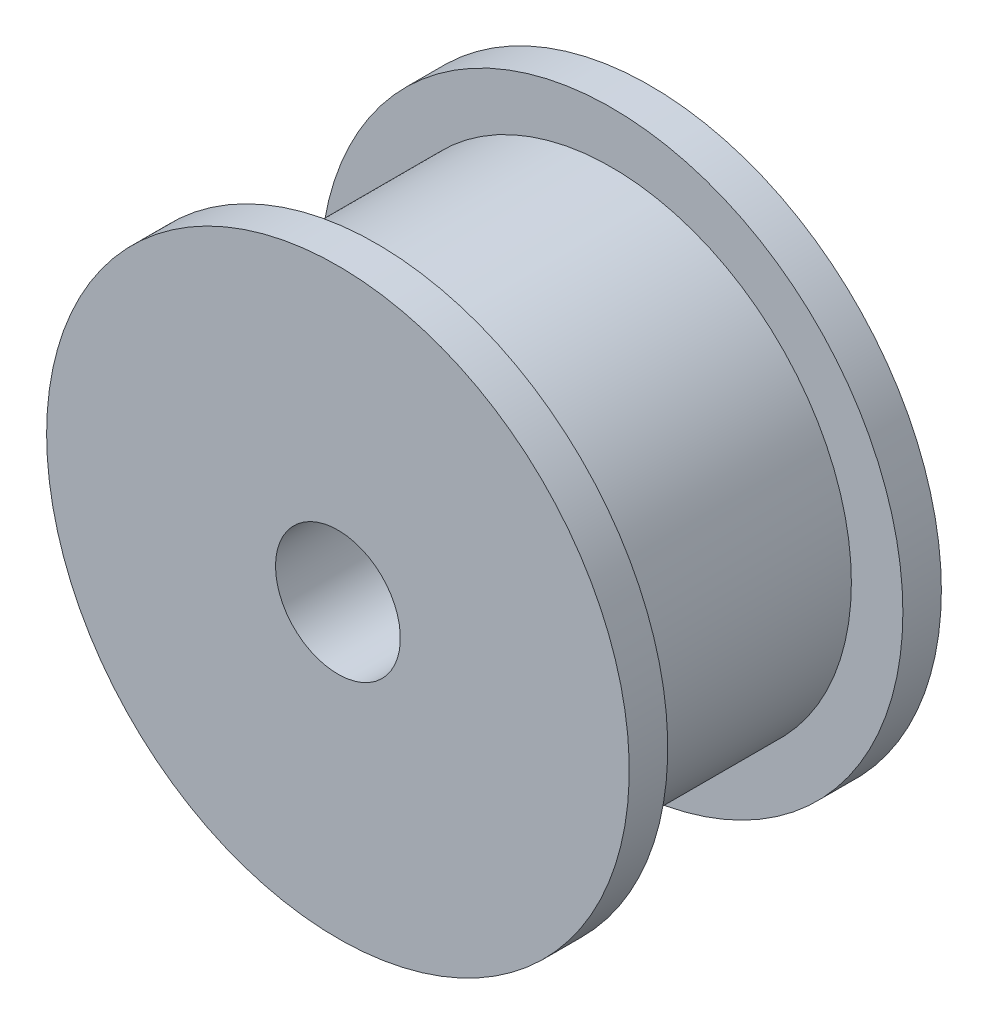
from build123d import *

# Parameters (mm, degrees)
CIRPATTERN2_COUNT       = 4
CHAMFER1_SIZE           = 0.3
CHAMFER2_SIZE           = 0.15
SKETCH6_R               = 5.05
CUT_EXTRUDE1_DEPTH      = 2
CHAMFER3_SIZE           = 0.3
SKETCH7_R               = 8
CUT_EXTRUDE2_DEPTH      = 6
CUT_EXTRUDE3_DEPTH      = 26.39125592
CUT_EXTRUDE3_DEPTH_BACK = 26.39125592
SKETCH10_R              = 22.04861813
SKETCH10_R_2            = 14


with BuildPart() as part:
    # Cut-Revolve1: read off the stored shape, not the designer's step
    # Cut-Revolve1 outline → Cut-Revolve1 (revolve)
    with BuildSketch(Plane.XZ):
        Polygon((11.525, 2.46), (15, 2.46), (16, 2.765730681), (15.628687935, 3.980237722), (14.810197228, 3.73), (8, 3.73), (8, 9.73), (3, 9.73), (3, -11.27), (14.810197228, -11.27), (15.628687935, -11.520237722), (16, -10.305730681), (15, -10), (11.525, -10), align=None)
    revolve(axis=Axis((0, 0, 0), (0, 0, 1)))

    # Sketch4 → M3 Tapped Hole2 (revolve, cut)
    with BuildSketch(Plane(origin=(0, -8, -11.27), x_dir=(0, 1, 0), z_dir=(1, 0, 0))):
        Polygon((0, 0), (0, 9.251075774), (1.25, 8.5), (1.25, 0), align=None)
    m3_tapped_hole2 = revolve(axis=Axis((0, -8, -17.62), (0, 0, 1)), mode=Mode.SUBTRACT)

    # CirPattern2: M3 Tapped Hole2 ×4 about axis
    cirpattern2_axis = Axis((0, 0, 0), (0, 0, 1))
    for i in range(1, CIRPATTERN2_COUNT):
        add(m3_tapped_hole2.rotate(cirpattern2_axis, i * 360 / CIRPATTERN2_COUNT), mode=Mode.SUBTRACT)

    # Chamfer1
    chamfer1_edges = [part.edges().sort_by_distance(p)[0] for p in [
        (-8, 0, 9.73),
    ]]
    chamfer(chamfer1_edges, length=CHAMFER1_SIZE)

    # Chamfer2
    chamfer2_edges = [part.edges().sort_by_distance(p)[0] for p in [
        (-3, 0, 9.73),
    ]]
    chamfer(chamfer2_edges, length=CHAMFER2_SIZE)

    # Sketch6 → Cut-Extrude1 (cut)
    with BuildSketch(Plane(origin=(0, 0, -11.27), x_dir=(-1, 0, 0), z_dir=(0, 0, -1))):
        Circle(SKETCH6_R)
    extrude(amount=-CUT_EXTRUDE1_DEPTH, mode=Mode.SUBTRACT)

    # Chamfer3
    chamfer3_edges = [part.edges().sort_by_distance(p)[0] for p in [
        (5.05, 0, -11.27),
    ]]
    chamfer(chamfer3_edges, length=CHAMFER3_SIZE)

    # Sketch7 → Cut-Extrude2 (cut)
    with BuildSketch(Plane.XY.offset(9.73)):
        Circle(SKETCH7_R)
    extrude(amount=-CUT_EXTRUDE2_DEPTH, mode=Mode.SUBTRACT)

    # Sketch9 → Revolve1 (revolve)
    with BuildSketch(Plane(origin=(0, 0, 0), x_dir=(1, 0, 0), z_dir=(0, 1, 0))):
        Polygon((-16, 10.305730681), (-14.85, 9.42), (-11.525, 9.42), (-11.525, 10.305730681), align=None)
        Polygon((-16, -2.765730681), (-14.85, -1.88), (-11.525, -1.88), (-11.525, -2.765730681), align=None)
    revolve(axis=Axis((0, 0, -10.305730681), (0, 0, 1)))

    # Sketch10 → Cut-Extrude3 (cut, two sides: drawn at the far end of the back side and taken through both)
    with BuildSketch(Plane.XY.offset(-CUT_EXTRUDE3_DEPTH_BACK)):
        Circle(SKETCH10_R)
        with Locations(Location((0, 0, 0), (0, 0, 180))):
            Circle(SKETCH10_R_2, mode=Mode.SUBTRACT)
    extrude(amount=CUT_EXTRUDE3_DEPTH + CUT_EXTRUDE3_DEPTH_BACK, mode=Mode.SUBTRACT)


solid = part.part
